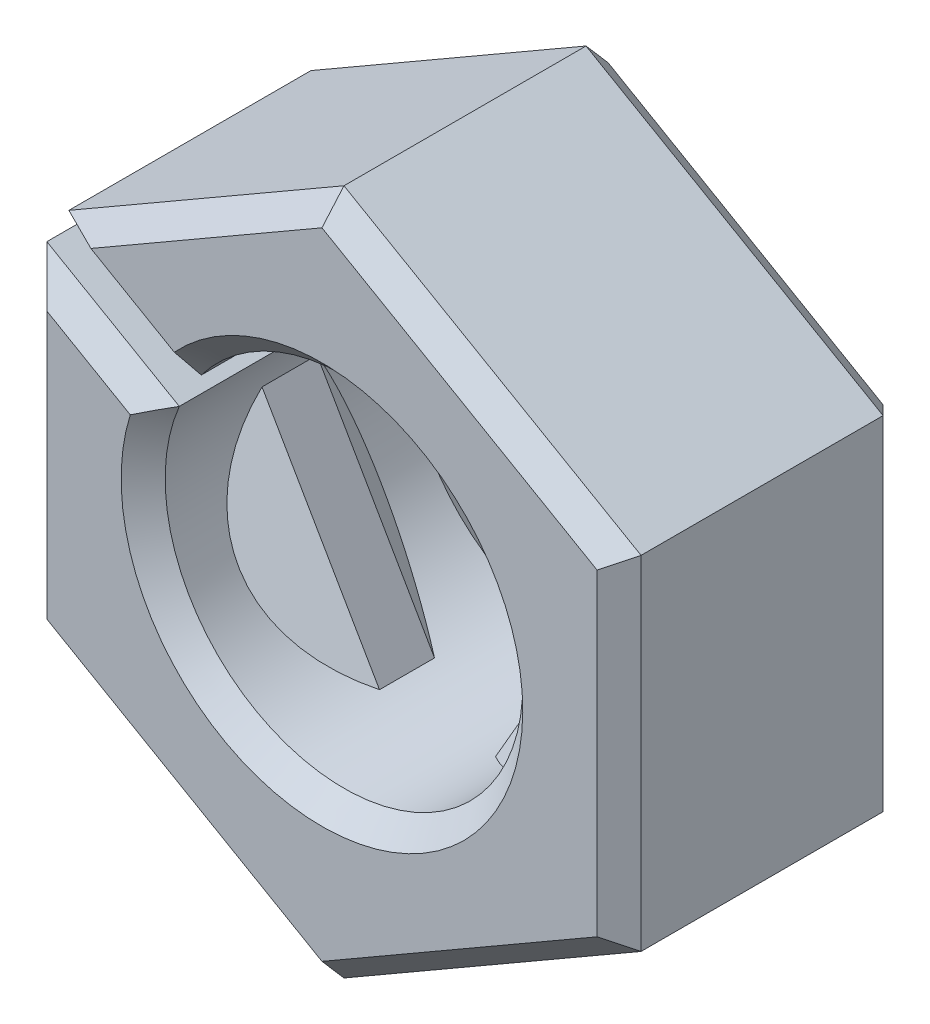
from build123d import *

# Parameters (mm, degrees)
SKETCH1_R              = 1.625
BOSS_EXTRUDE1_DEPTH    = 1.3
CLIP_REACH             = 6.324
CLIP_DIRECTION_2_REACH = 6.324
CLIPS_X3_COUNT         = 3
SPLIT_2_DEPTH          = 5.324349662
SPLIT_2_DEPTH_BACK     = 5.324349662
DEBURS_SIZE            = 0.2


with BuildPart() as part:
    # Sketch1 → Boss-Extrude1 (new, symmetric)
    with BuildSketch(Plane.XY):
        Polygon((2.7, -1.558845727), (2.7, 1.558845727), (0, 3.117691454), (-2.7, 1.558845727), (-2.7, -1.558845727), (0, -3.117691454), align=None)
        Circle(SKETCH1_R, mode=Mode.SUBTRACT)
    extrude(amount=BOSS_EXTRUDE1_DEPTH, both=True)

    # Sketch3 → Clip (add, up to next)
    with BuildSketch(Plane(origin=(0, 0, 0), x_dir=(0, 0, -1), z_dir=(1, 0, 0)), mode=Mode.PRIVATE) as clip_sk1:
        Polygon((-0.65, 1.625), (0.65, 1.625), (0.25, 1.225), (-0.25, 1.225), align=None)
    clip_tool1 = extrude(clip_sk1.sketch, amount=CLIP_REACH, mode=Mode.PRIVATE) - part.part
    clip = clip_tool1.solids().sort_by_distance((0, 1.45463, 0))[0]
    add(clip)

    # Sketch3 → Clip direction 2 (add, up to next)
    with BuildSketch(Plane(origin=(0, 0, 0), x_dir=(0, 0, -1), z_dir=(1, 0, 0)), mode=Mode.PRIVATE) as clip_direction_2_sk1:
        Polygon((-0.65, 1.625), (0.65, 1.625), (0.25, 1.225), (-0.25, 1.225), align=None)
    clip_direction_2_tool1 = extrude(clip_direction_2_sk1.sketch, amount=-CLIP_DIRECTION_2_REACH, mode=Mode.PRIVATE) - part.part
    clip_direction_2 = clip_direction_2_tool1.solids().sort_by_distance((0, 1.45463, 0))[0]
    add(clip_direction_2)

    # Clips x3: Clip, Clip direction 2 ×3 about axis
    clips_x3_axis = Axis((0, 0, 1.3), (0, 0, 1))
    add([clip.rotate(clips_x3_axis, i * 360 / CLIPS_X3_COUNT) for i in range(1, CLIPS_X3_COUNT)])
    add([clip_direction_2.rotate(clips_x3_axis, i * 360 / CLIPS_X3_COUNT) for i in range(1, CLIPS_X3_COUNT)])

    # Sketch4 → Split 2 (cut, two sides: drawn at the far end of the back side and taken through both)
    with BuildSketch(Plane.XY.offset(-SPLIT_2_DEPTH_BACK)):
        Polygon((-2.8, 1.385640646), (-0.1, -0.173205081), (0.1, 0.173205081), (-2.6, 1.732050808), align=None)
    extrude(amount=SPLIT_2_DEPTH + SPLIT_2_DEPTH_BACK, mode=Mode.SUBTRACT)

    # Deburs
    deburs_edges = [part.edges().sort_by_distance(p)[0] for p in [
        (-0.323004079, -1.592574446, -1.3),
        (2.7, 0, -1.3),
        (1.35, 2.33826859, -1.3),
        (-1.25, 2.396003617, -1.3),
        (-2.7, -0.115470054, -1.3),
        (-1.35, -2.33826859, -1.3),
        (1.35, -2.33826859, -1.3),
        (-0.323004079, -1.592574446, 1.3),
        (-1.35, -2.33826859, 1.3),
        (-2.7, -0.115470054, 1.3),
        (-1.25, 2.396003617, 1.3),
        (1.35, 2.33826859, 1.3),
        (2.7, 0, 1.3),
        (1.35, -2.33826859, 1.3),
        (-1.898295917, 1.326921766, -1.3),
        (-2.098295917, 0.980511605, -1.3),
        (-1.898295917, 1.326921766, 1.3),
        (-2.098295917, 0.980511605, 1.3),
    ]]
    chamfer(deburs_edges, length=DEBURS_SIZE)


solid = part.part
